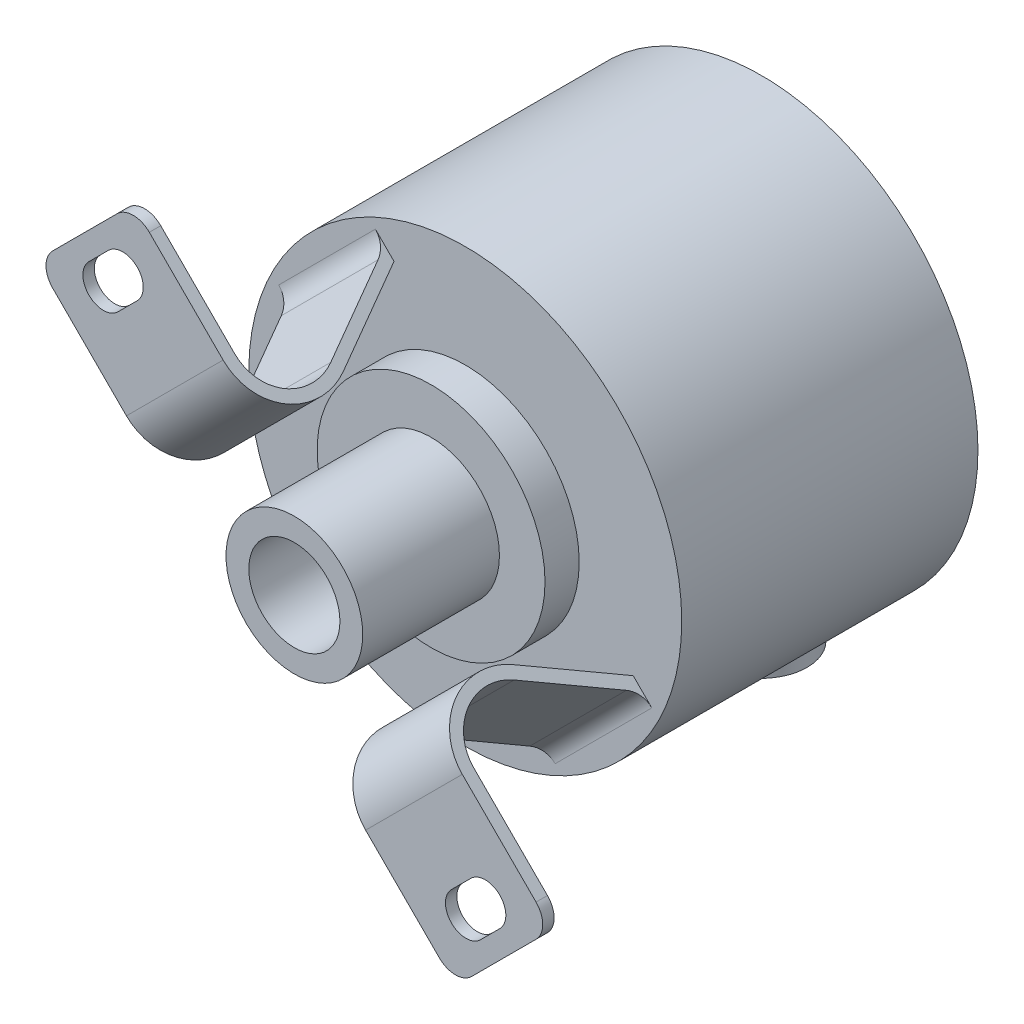
from build123d import *

# Parameters (mm, degrees)
SKETCH1_R           = 19
BOSS_EXTRUDE1_DEPTH = 26
SKETCH2_R           = 10
BOSS_EXTRUDE2_DEPTH = 3
SKETCH3_R           = 6
BOSS_EXTRUDE3_DEPTH = 12
SKETCH4_R           = 4
CUT_EXTRUDE1_DEPTH  = 10
SKETCH5_R           = 4
BOSS_EXTRUDE4_DEPTH = 24
FILLET1_R           = 4
BOSS_EXTRUDE5_DEPTH = 6
CUT_EXTRUDE2_REACH  = 57.794
FILLET2_R           = 2
FILLET3_R           = 2


with BuildPart() as part:
    # Sketch1 → Boss-Extrude1 (new body)
    with BuildSketch(Plane.XY):
        with Locations(Location((0, 0, 0), (0, 0, 180))):
            Circle(SKETCH1_R)
    extrude(amount=BOSS_EXTRUDE1_DEPTH)

    # Sketch2 → Boss-Extrude2 (add)
    with BuildSketch(Plane.XY.offset(26)):
        Circle(SKETCH2_R)
    extrude(amount=BOSS_EXTRUDE2_DEPTH)

    # Sketch3 → Boss-Extrude3 (add)
    with BuildSketch(Plane.XY.offset(29)):
        Circle(SKETCH3_R)
    extrude(amount=BOSS_EXTRUDE3_DEPTH)

    # Sketch4 → Cut-Extrude1 (cut)
    with BuildSketch(Plane.XY.offset(41)):
        Circle(SKETCH4_R)
    extrude(amount=-CUT_EXTRUDE1_DEPTH, mode=Mode.SUBTRACT)

    # Sketch5 → Boss-Extrude4 (add)
    with BuildSketch(Plane(origin=(0, 0, 0), x_dir=(1, 0, 0), z_dir=(0, 1, 0))):
        with Locations(Location((0, 0, 0), (0, 0, 270))):
            Circle(SKETCH5_R)
    extrude(amount=-BOSS_EXTRUDE4_DEPTH)

    # Fillet1
    fillet1_edges = [part.edges().sort_by_distance(p)[0] for p in [
        (0, 0, -4),
    ]]
    fillet(fillet1_edges, radius=FILLET1_R - 0.0001)  # a hair under: the kernel refuses the full size

    # Sketch6 → Boss-Extrude5 (add, symmetric)
    with BuildSketch(Plane(origin=(0, 0, 0), x_dir=(-0.7071067811865464, 0.7071067811865488, 0), z_dir=(0.7071067811865488, 0.7071067811865464, 0))):
        with BuildLine():
            Line((-14.845299462, 26), (-10.515172443, 33.5))
            ThreePointArc((-10.515172443, 33.5), (-10.515172443, 38.5), (-14.845299462, 41))
            Line((-14.845299462, 41), (-26, 41))
            Line((-26, 41), (-26, 40))
            Line((-26, 40), (-14.845299462, 40))
            ThreePointArc((-14.845299462, 40), (-11.381197846, 38), (-11.381197846, 34))
            Line((-11.381197846, 34), (-16, 26))
            Line((-16, 26), (-14.845299462, 26))
        make_face()
        with BuildLine():
            Line((26, 41), (26, 40))
            Line((26, 40), (14.845299462, 40))
            ThreePointArc((14.845299462, 40), (11.381197846, 38), (11.381197846, 34))
            Line((11.381197846, 34), (16, 26))
            Line((16, 26), (14.845299462, 26))
            Line((14.845299462, 26), (10.515172443, 33.5))
            ThreePointArc((10.515172443, 33.5), (10.515172443, 38.5), (14.845299462, 41))
            Line((14.845299462, 41), (26, 41))
        make_face()
    extrude(amount=BOSS_EXTRUDE5_DEPTH, both=True)

    # Sketch7 → Cut-Extrude2 (cut, up to next)
    with BuildSketch(Plane.XY.offset(41), mode=Mode.PRIVATE) as cut_extrude2_sk1:
        with BuildLine():
            Line((-18.03122292, 16.334166645), (-16.334166645, 18.03122292))
            ThreePointArc((-16.334166645, 18.03122292), (-13.788582233, 18.03122292), (-13.788582233, 15.485638508))
            Line((-13.788582233, 15.485638508), (-15.485638508, 13.788582233))
            ThreePointArc((-15.485638508, 13.788582233), (-18.03122292, 13.788582233), (-18.03122292, 16.334166645))
        make_face()
    cut_extrude2_tool1 = extrude(cut_extrude2_sk1.sketch, amount=-CUT_EXTRUDE2_REACH, mode=Mode.PRIVATE) & part.part
    # Sketch7 → Cut-Extrude2 (cut, up to next)
    with BuildSketch(Plane.XY.offset(41), mode=Mode.PRIVATE) as cut_extrude2_sk2:
        with BuildLine():
            Line((15.485638508, -13.788582233), (13.788582233, -15.485638508))
            ThreePointArc((13.788582233, -15.485638508), (13.788582233, -18.03122292), (16.334166645, -18.03122292))
            Line((16.334166645, -18.03122292), (18.03122292, -16.334166645))
            ThreePointArc((18.03122292, -16.334166645), (18.03122292, -13.788582233), (15.485638508, -13.788582233))
        make_face()
    cut_extrude2_tool2 = extrude(cut_extrude2_sk2.sketch, amount=-CUT_EXTRUDE2_REACH, mode=Mode.PRIVATE) & part.part
    add(cut_extrude2_tool1.solids().sort_by_distance((-15.909903, 15.909903, 41))[0], mode=Mode.SUBTRACT)
    add(cut_extrude2_tool2.solids().sort_by_distance((15.909903, -15.909903, 41))[0], mode=Mode.SUBTRACT)

    # Fillet2
    fillet2_edges = [part.edges().sort_by_distance(p)[0] for p in [
        (14.142135624, -22.627416998, 40.5),
        (22.627416998, -14.142135624, 40.5),
        (-22.627416998, 14.142135624, 40.5),
        (-14.142135624, 22.627416998, 40.5),
    ]]
    fillet(fillet2_edges, radius=FILLET2_R)

    # Fillet3
    fillet3_edges = [part.edges().sort_by_distance(p)[0] for p in [
        (11.313708499, -11.313708499, 26),
        (-11.313708499, 11.313708499, 26),
    ]]
    fillet(fillet3_edges, radius=FILLET3_R)


solid = part.part
